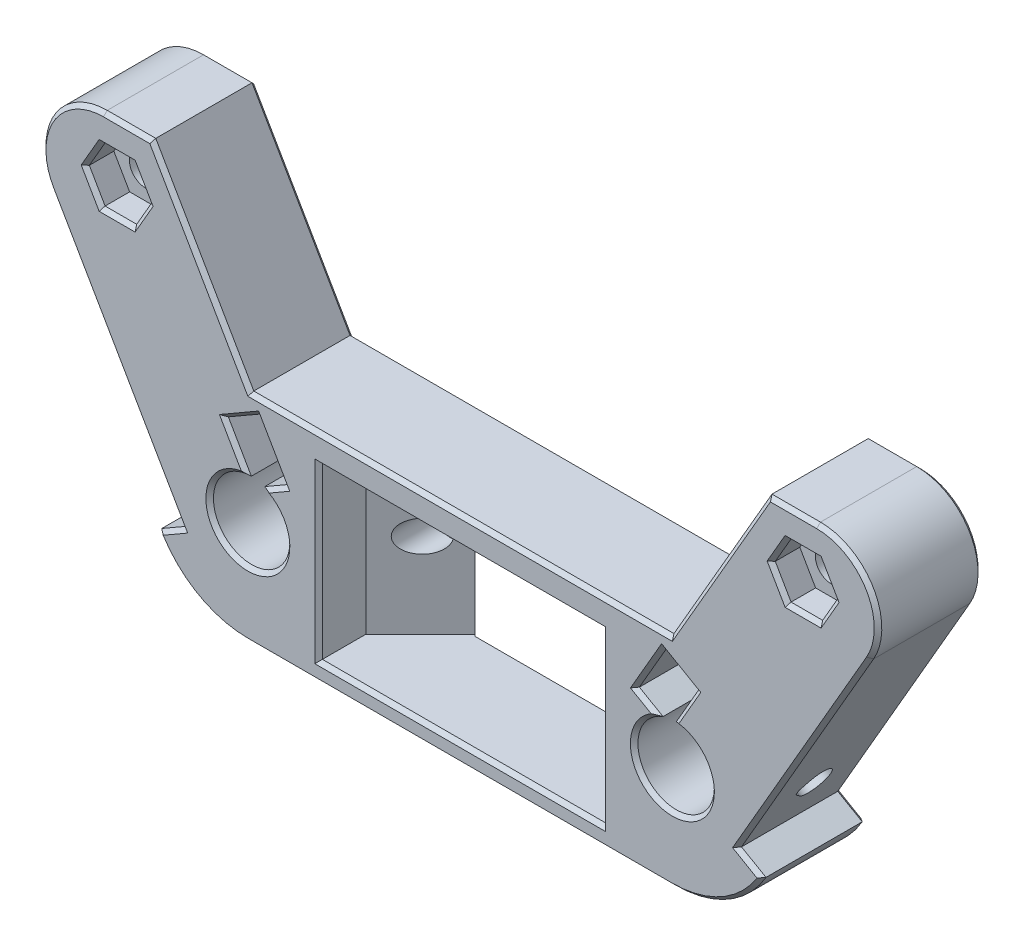
from build123d import *

# Parameters (mm, degrees)
SKETCH1_R           = 4.05
SKETCH1_R_2         = 1.7
SKETCH1_W           = 18
SKETCH1_H           = 18
BOSS_EXTRUDE1_DEPTH = 11
SKETCH11_W          = 30
SKETCH11_H          = 18
CUT_EXTRUDE9_DEPTH  = 5
CUT_EXTRUDE4_DEPTH  = 16
CUT_EXTRUDE5_START  = -10
CUT_EXTRUDE5_DEPTH  = 4
CUT_EXTRUDE7_DEPTH  = 57.773728613
CUT_EXTRUDE8_DEPTH  = 3
CHAMFER1_SIZE       = 0.4
CHAMFER2_SIZE       = 0.4
CHAMFER3_SIZE       = 6
SKETCH12_R          = 1.65
CUT_EXTRUDE10_DEPTH = 55.621156131


with BuildPart() as part:
    # Sketch1 → Boss-Extrude1 (new body)
    with BuildSketch(Plane.XY):
        with BuildLine():
            Line((-29.42820323, -4), (-46.92820323, 26.310889132))
            Line((-46.92820323, 26.310889132), (-40.538475773, 30))
            Line((-40.538475773, 30), (-32.661364738, 30))
            Line((-32.661364738, 30), (-22.269059892, 12))
            Line((-22.269059892, 12), (22.269059892, 12))
            Line((22.269059892, 12), (32.661364738, 30))
            Line((32.661364738, 30), (40.538475773, 30))
            Line((40.538475773, 30), (46.92820323, 26.310889132))
            Line((46.92820323, 26.310889132), (29.42820323, -4))
            Line((29.42820323, -4), (32.026279442, -5.5))
            ThreePointArc((32.026279442, -5.5), (28, -9.526279442), (22.5, -11))
            Line((22.5, -11), (-22.5, -11))
            ThreePointArc((-22.5, -11), (-28, -9.526279442), (-32.026279442, -5.5))
            Line((-32.026279442, -5.5), (-29.42820323, -4))
        make_face()
        with Locations((-22.5, 0)):
            Circle(SKETCH1_R, mode=Mode.SUBTRACT)
        with Locations(Location((22.5, 0, 0), (0, 0, 180))):
            Circle(SKETCH1_R, mode=Mode.SUBTRACT)
        with Locations((-36.356406461, 24)):
            Circle(SKETCH1_R_2, mode=Mode.SUBTRACT)
        with Locations((36.356406461, 24)):
            Circle(SKETCH1_R_2, mode=Mode.SUBTRACT)
        Rectangle(SKETCH1_W, SKETCH1_H, mode=Mode.SUBTRACT)
    extrude(amount=BOSS_EXTRUDE1_DEPTH)

    # Sketch11 → Cut-Extrude9 (cut)
    with BuildSketch(Plane.XY.offset(11)):
        Rectangle(SKETCH11_W, SKETCH11_H)
    extrude(amount=-CUT_EXTRUDE9_DEPTH, mode=Mode.SUBTRACT)

    # Sketch6 → Cut-Extrude4 (cut)
    with BuildSketch(Plane(origin=(-23.80320323, -13.742785793, 0), x_dir=(0, 0, 1), z_dir=(-0.8660254037844398, -0.4999999999999983, 0))):
        with BuildLine():
            Line((6.63137085, 15.61862915), (7.42, 16.4072583))
            Line((7.42, 16.4072583), (7.42, 17.0927417))
            Line((7.42, 17.0927417), (6.63137085, 17.88137085))
            ThreePointArc((6.63137085, 17.88137085), (3.9, 16.75), (6.63137085, 15.61862915))
        make_face()
    cut_extrude4 = extrude(amount=-CUT_EXTRUDE4_DEPTH, mode=Mode.SUBTRACT)

    # Sketch7 → Cut-Extrude5 (cut)
    with BuildSketch(Plane(origin=(-23.80320323, -13.742785793, 0), x_dir=(0, 0, 1), z_dir=(-0.8660254037844398, -0.4999999999999983, 0)).offset(CUT_EXTRUDE5_START)):
        Polygon((11, 19.65), (11, 13.85), (3.625684219, 13.85), (1.951368439, 16.75), (3.625684219, 19.65), align=None)
    cut_extrude5 = extrude(amount=-CUT_EXTRUDE5_DEPTH, mode=Mode.SUBTRACT)

    # Mirror2: Cut-Extrude4, Cut-Extrude5 across plane
    add(cut_extrude4.mirror(Plane(origin=(0, 0, 0), x_dir=(0, 0, 1), z_dir=(1, 0, 0))), mode=Mode.SUBTRACT)
    add(cut_extrude5.mirror(Plane(origin=(0, 0, 0), x_dir=(0, 0, 1), z_dir=(1, 0, 0))), mode=Mode.SUBTRACT)

    # Sketch9 → Cut-Extrude7 (cut, through all)
    with BuildSketch(Plane.XY.offset(11)):
        with BuildLine():
            Line((-43.428947258, 20.25), (-46.92820323, 26.310889132))
            Line((-46.92820323, 26.310889132), (-40.538475773, 30))
            Line((-40.538475773, 30), (-37.799782134, 30))
            ThreePointArc((-37.799782134, 30), (-43.428947258, 26.75), (-43.428947258, 20.25))
        make_face()
        with BuildLine():
            Line((40.538475773, 30), (37.799782134, 30))
            ThreePointArc((37.799782134, 30), (43.428947258, 26.75), (43.428947258, 20.25))
            Line((43.428947258, 20.25), (46.92820323, 26.310889132))
            Line((46.92820323, 26.310889132), (40.538475773, 30))
        make_face()
    extrude(amount=-CUT_EXTRUDE7_DEPTH, mode=Mode.SUBTRACT)

    # Sketch10 → Cut-Extrude8 (cut)
    with BuildSketch(Plane.XY.offset(11)):
        Polygon((39.705038022, 24), (38.030722241, 26.9), (34.68209068, 26.9), (33.007774899, 24), (34.68209068, 21.1), (38.030722241, 21.1), align=None)
        Polygon((-33.007774899, 24), (-34.68209068, 26.9), (-38.030722241, 26.9), (-39.705038022, 24), (-38.030722241, 21.1), (-34.68209068, 21.1), align=None)
    extrude(amount=-CUT_EXTRUDE8_DEPTH, mode=Mode.SUBTRACT)

    # Chamfer1
    chamfer1_edges = [part.edges().sort_by_distance(p)[0] for p in [
        (0, -11, 11),
        (-25.353578994, -2.873949708, 11),
        (-23.748378775, 6.162255466, 11),
        (-20.053847577, 7.763139721, 11),
        (-23.235898385, 9.274613392, 11),
        (-19.857316504, 4.527975428, 11),
        (28, -9.526279442, 11),
        (30.727241336, -4.75, 11),
        (25.353578994, -2.873949708, 11),
        (23.235898385, 9.274613392, 11),
        (19.857316504, 4.527975428, 11),
        (23.748378775, 6.162255466, 11),
        (20.053847577, 7.763139721, 11),
        (36.428575244, 8.125, 11),
        (-36.428575244, 8.125, 11),
        (-43.428947258, 26.75, 11),
        (35.230573436, 30, 11),
        (43.428947258, 26.75, 11),
        (38.867880132, 22.55, 11),
        (38.867880132, 25.45, 11),
        (36.356406461, 26.9, 11),
        (33.84493279, 25.45, 11),
        (33.84493279, 22.55, 11),
        (36.356406461, 21.1, 11),
        (-33.84493279, 22.55, 11),
        (-33.84493279, 25.45, 11),
        (-36.356406461, 26.9, 11),
        (-38.867880132, 25.45, 11),
        (-38.867880132, 22.55, 11),
        (-36.356406461, 21.1, 11),
        (27.465212315, 21, 11),
        (0, 12, 11),
        (-27.465212315, 21, 11),
        (-35.230573436, 30, 11),
        (-30.727241336, -4.75, 11),
        (0, -9, 11),
        (0, 9, 11),
        (-28, -9.526279442, 11),
        (-15, 0, 11),
        (15, 0, 11),
    ]]
    chamfer(chamfer1_edges, length=CHAMFER1_SIZE)

    # Chamfer2
    chamfer2_edges = [part.edges().sort_by_distance(p)[0] for p in [
        (-35.230573436, 30, 0),
        (-27.465212315, 21, 0),
        (0, 12, 0),
        (27.465212315, 21, 0),
        (36.428575244, 8.125, 0),
        (30.727241336, -4.75, 0),
        (28, -9.526279442, 0),
        (0, -11, 0),
        (-28, -9.526279442, 0),
        (-30.727241336, -4.75, 0),
        (-36.428575244, 8.125, 0),
        (-43.428947258, 26.75, 0),
        (35.230573436, 30, 0),
        (43.428947258, 26.75, 0),
        (-26.55, 0, 0),
        (26.55, 0, 0),
        (-9, 0, 0),
        (0, -9, 0),
        (9, 0, 0),
        (0, 9, 0),
        (-38.056406461, 24, 0),
        (34.656406461, 24, 0),
    ]]
    chamfer(chamfer2_edges, length=CHAMFER2_SIZE)

    # Chamfer3
    # the kernel refuses this chamfer: 6 mm, written as the material it takes off along each edge
    with BuildSketch(Plane(origin=(-9, -9, 6), x_dir=(0.02749587661058649, 0, -0.9996219169112968), z_dir=(0, 1, 0)), Plane(origin=(9, 9, 6), x_dir=(-0.02749587661058649, 0, -0.9996219169112968), z_dir=(0, -1, 0))) as chamfer3_piece_1:
        Polygon((CHAMFER3_SIZE * 0.999621916911, CHAMFER3_SIZE * 0.0274958766106), (-CHAMFER3_SIZE * 0.0274958766106, CHAMFER3_SIZE * 0.999621916911), (0, 0), align=None)
    extrude(amount=18, mode=Mode.SUBTRACT)

    # Sketch12 → Cut-Extrude10 (cut, through all)
    with BuildSketch(Plane(origin=(0, 0, 0), x_dir=(-1, 0, 0), z_dir=(0, 0, -1))):
        with Locations((12, 0)):
            Circle(SKETCH12_R)
        with Locations((-12, 0)):
            Circle(SKETCH12_R)
    extrude(amount=-CUT_EXTRUDE10_DEPTH, mode=Mode.SUBTRACT)


solid = part.part
